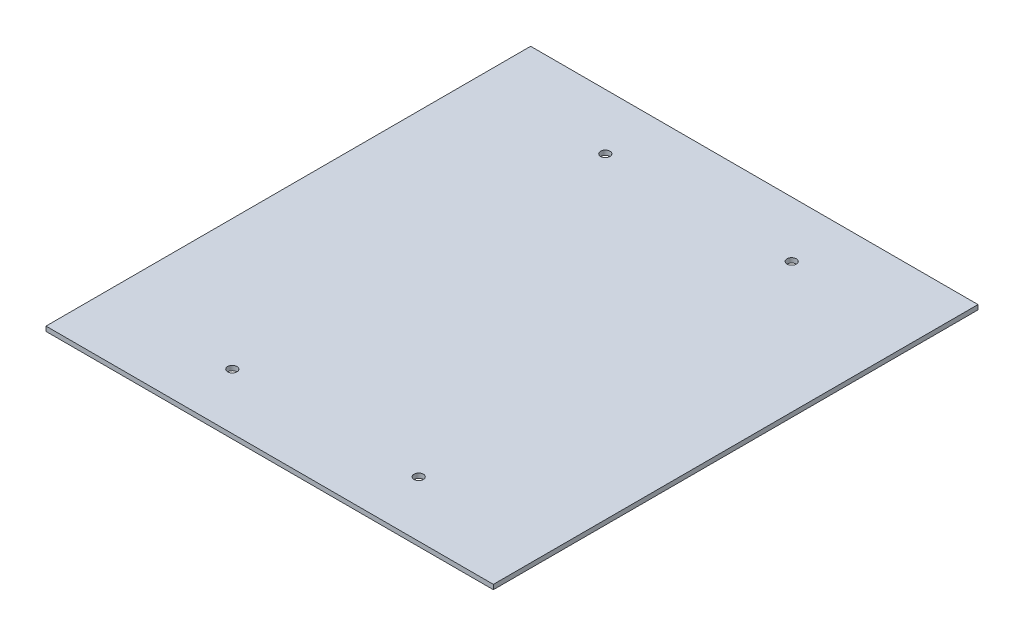
from build123d import *

# Parameters (mm, degrees)
SKETCH2_W          = 304.8
SKETCH2_H          = 330.2
BASE_FLANGE1_DEPTH = 3.175
SKETCH7_R          = 3.175
CUT_EXTRUDE1_DEPTH = 225.708367946


# Sheet-metal steps are written as plain solids
with BuildPart() as part:
    # Sketch2 → Base-Flange1 (new body)
    with BuildSketch(Plane(origin=(0, 0, 0), x_dir=(1, 0, 0), z_dir=(0, 1, 0))):
        Rectangle(SKETCH2_W, SKETCH2_H)
    extrude(amount=-BASE_FLANGE1_DEPTH)

    # Sketch7 → Cut-Extrude1 (cut, through all)
    with BuildSketch(Plane(origin=(0, 0, 0), x_dir=(1, 0, 0), z_dir=(0, 1, 0))):
        with Locations(Location((-63.5, 127.06, 0), (0, 0, 270))):
            Circle(SKETCH7_R)
        with Locations(Location((63.5, 127.06, 0), (0, 0, 270))):
            Circle(SKETCH7_R)
        with Locations(Location((63.5, -127.06, 0), (0, 0, 270))):
            Circle(SKETCH7_R)
        with Locations(Location((-63.5, -127.06, 0), (0, 0, 270))):
            Circle(SKETCH7_R)
    extrude(amount=-CUT_EXTRUDE1_DEPTH, mode=Mode.SUBTRACT)


solid = part.part
